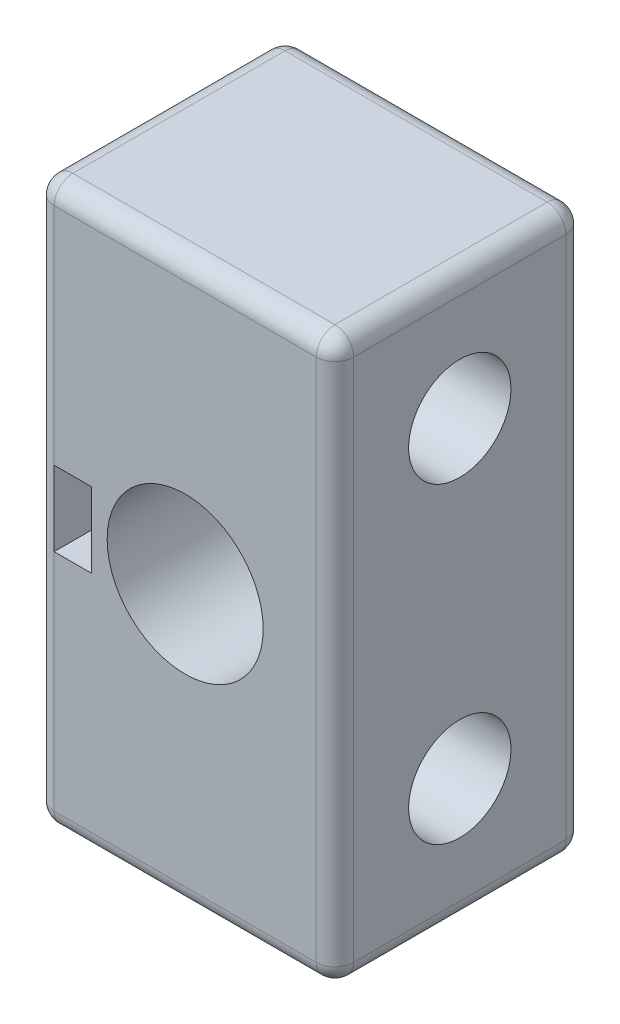
from build123d import *

# Parameters (mm, degrees)
SKETCH1_W      = 24
SKETCH1_H      = 45
EXTRUDE1_DEPTH = 20
SKETCH2_R      = 4.1
EXTRUDE2_DEPTH = 39.5
SKETCH3_R      = 6.25
EXTRUDE3_DEPTH = 18
SKETCH4_R      = 4.75
EXTRUDE4_DEPTH = 18
SKETCH5_W      = 3
SKETCH5_H      = 6
EXTRUDE5_DEPTH = 14
SKETCH6_R      = 1.5
EXTRUDE6_DEPTH = 13
FILLET1_R      = 1.5
FILLET2_R      = 0.5
FILLET3_R      = 3


with BuildPart() as part:
    # Sketch1 → Extrude1 (new body)
    with BuildSketch(Plane.XY):
        Rectangle(SKETCH1_W, SKETCH1_H)
    extrude(amount=EXTRUDE1_DEPTH)

    # Sketch2 → Extrude2 (cut, through all)
    with BuildSketch(Plane(origin=(12, 0, 0), x_dir=(0, 0, -1), z_dir=(1, 0, 0))):
        with Locations((-10, 12.5)):
            Circle(SKETCH2_R)
        with Locations(Location((-10, -12.5, 0), (0, 0, 180))):
            Circle(SKETCH2_R)
    extrude(amount=-EXTRUDE2_DEPTH, mode=Mode.SUBTRACT)

    # Sketch3 → Extrude3 (cut)
    with BuildSketch(Plane.XY.offset(20)):
        Circle(SKETCH3_R)
    extrude(amount=-EXTRUDE3_DEPTH, mode=Mode.SUBTRACT)

    # Sketch4 → Extrude4 (cut)
    with BuildSketch(Plane.XY.offset(2)):
        Circle(SKETCH4_R)
    extrude(amount=-EXTRUDE4_DEPTH, mode=Mode.SUBTRACT)

    # Sketch5 → Extrude5 (cut)
    with BuildSketch(Plane.XY.offset(20)):
        with Locations((-9, 0)):
            Rectangle(SKETCH5_W, SKETCH5_H)
    extrude(amount=-EXTRUDE5_DEPTH, mode=Mode.SUBTRACT)

    # Sketch6 → Extrude6 (cut)
    with BuildSketch(Plane.ZY.offset(12)):
        with Locations((10, 0)):
            Circle(SKETCH6_R)
    extrude(amount=-EXTRUDE6_DEPTH, mode=Mode.SUBTRACT)

    # Fillet1
    fillet1_edges = [part.edges().sort_by_distance(p)[0] for p in [
        (12, 0, 20),
        (0, 22.5, 20),
        (-12, 0, 20),
        (0, 22.5, 0),
        (12, 0, 0),
        (0, -22.5, 0),
        (-12, 0, 0),
        (0, -22.5, 20),
        (-12, 22.5, 10),
        (12, 22.5, 10),
        (12, -22.5, 10),
        (-12, -22.5, 10),
    ]]
    fillet(fillet1_edges, radius=FILLET1_R - 0.0001)  # a hair under: the kernel refuses the full size

    # Fillet2
    fillet2_edges = [part.edges().sort_by_distance(p)[0] for p in [
        (-4.75, 0, 2),
    ]]
    fillet(fillet2_edges, radius=FILLET2_R)

    # Fillet3
    fillet3_edges = [part.edges().sort_by_distance(p)[0] for p in [
        (-9, -3, 6),
        (-9, 3, 6),
    ]]
    fillet(fillet3_edges, radius=FILLET3_R - 0.0001)  # a hair under: the kernel refuses the full size


solid = part.part
